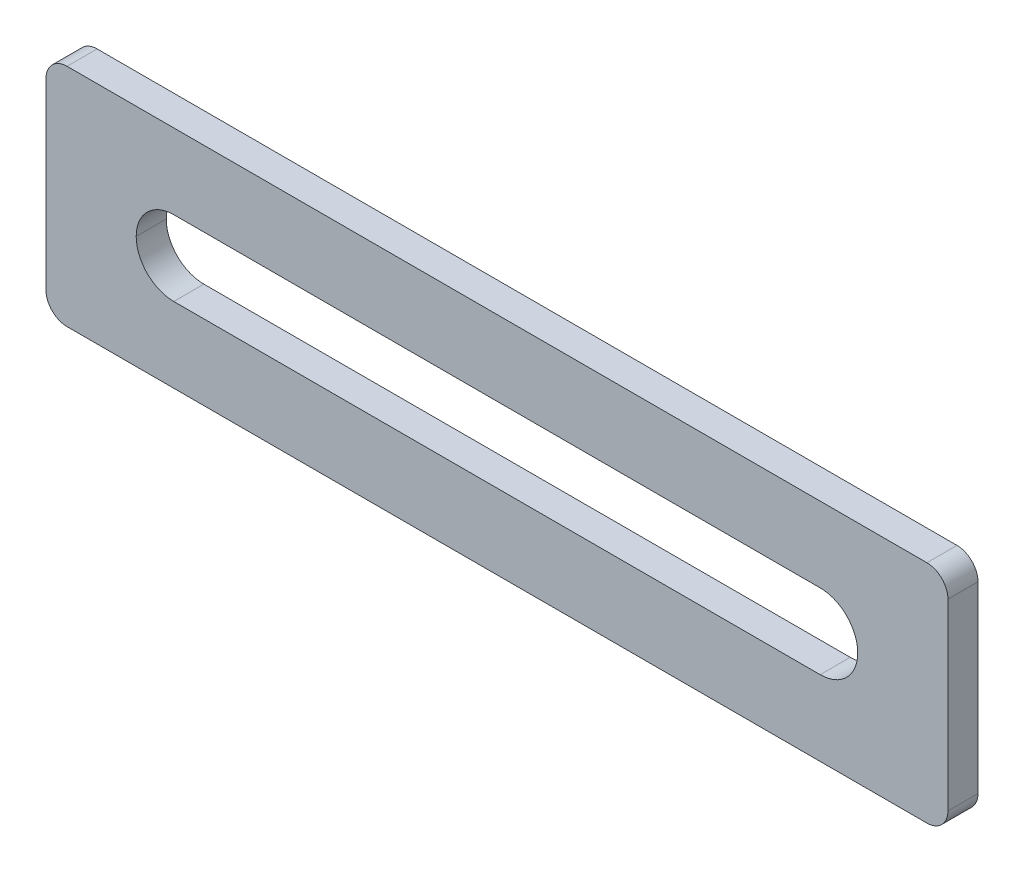
from build123d import *

# Parameters (mm, degrees)
SKETCH1_W           = 76.2
SKETCH1_H           = 19.05
BOSS_EXTRUDE1_DEPTH = 2.54
SKETCH2_W           = 60.96
SKETCH2_H           = 6.35
CUT_EXTRUDE1_DEPTH  = 2.54
FILLET1_R           = 3.175
FILLET2_R           = 1.778


with BuildPart() as part:
    # Sketch1 → Boss-Extrude1 (new body)
    with BuildSketch(Plane.XY):
        with Locations((38.1, 9.525)):
            Rectangle(SKETCH1_W, SKETCH1_H)
    extrude(amount=BOSS_EXTRUDE1_DEPTH)

    # Sketch2 → Cut-Extrude1 (cut)
    with BuildSketch(Plane.XY.offset(2.54)):
        with Locations((38.1, 9.525)):
            Rectangle(SKETCH2_W, SKETCH2_H)
    extrude(amount=-CUT_EXTRUDE1_DEPTH, mode=Mode.SUBTRACT)

    # Fillet1
    fillet1_edges = [part.edges().sort_by_distance(p)[0] for p in [
        (68.58, 6.35, 1.27),
        (7.62, 12.7, 1.27),
        (7.62, 6.35, 1.27),
        (68.58, 12.7, 1.27),
    ]]
    fillet(fillet1_edges, radius=FILLET1_R - 0.0001)  # a hair under: the kernel refuses the full size

    # Fillet2
    fillet2_edges = [part.edges().sort_by_distance(p)[0] for p in [
        (0, 19.05, 1.27),
        (76.2, 19.05, 1.27),
        (76.2, 0, 1.27),
        (0, 0, 1.27),
    ]]
    fillet(fillet2_edges, radius=FILLET2_R)


solid = part.part
